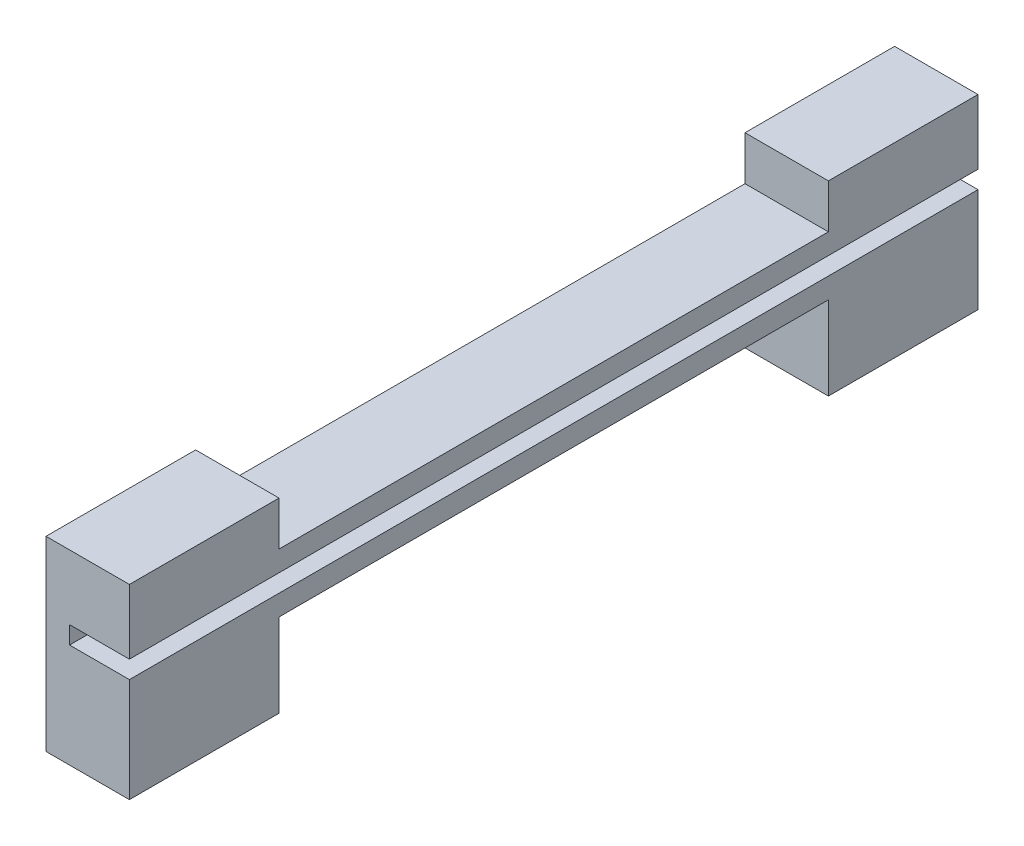
from build123d import *

# Parameters (mm, degrees)
BOSS_EXTRUDE2_DEPTH = 8.5
SKETCH6_W           = 6
SKETCH6_H           = 1.7
CUT_EXTRUDE3_DEPTH  = 89.201473911
SKETCH20_W          = 8.5
SKETCH20_H          = 15.25
BOSS_EXTRUDE3_DEPTH = 4
SKETCH23_W          = 8.5
SKETCH23_H          = 15.25
BOSS_EXTRUDE4_DEPTH = 4
SKETCH45_W          = 6
SKETCH45_H          = 86.5
CUT_EXTRUDE7_DEPTH  = 0.05
SKETCH46_W          = 86.5
SKETCH46_H          = 1.75
CUT_EXTRUDE8_DEPTH  = 0.1
SKETCH47_W          = 6.1
SKETCH47_H          = 86.5
CUT_EXTRUDE9_DEPTH  = 0.05


with BuildPart() as part:
    # Sketch5 → Boss-Extrude2 (new body)
    with BuildSketch(Plane(origin=(0, 0, 0), x_dir=(0, 0, -1), z_dir=(1, 0, 0))):
        Polygon((0, 0), (15.25, 0), (15.25, 4.5), (71.25, 4.5), (71.25, 0), (86.5, 0), (86.5, 15), (71.25, 15), (71.25, 10.5), (15.25, 10.5), (15.25, 15), (0, 15), align=None)
    extrude(amount=BOSS_EXTRUDE2_DEPTH)

    # Sketch6 → Cut-Extrude3 (cut, through all)
    with BuildSketch(Plane.XY):
        with Locations((5.5, 7.5)):
            Rectangle(SKETCH6_W, SKETCH6_H)
    extrude(amount=-CUT_EXTRUDE3_DEPTH, mode=Mode.SUBTRACT)

    # Sketch20 → Boss-Extrude3 (add)
    with BuildSketch(Plane.XZ):
        with Locations((4.25, -7.625)):
            Rectangle(SKETCH20_W, SKETCH20_H)
    extrude(amount=BOSS_EXTRUDE3_DEPTH)

    # Sketch23 → Boss-Extrude4 (add)
    with BuildSketch(Plane.XZ):
        with Locations((4.25, -78.875)):
            Rectangle(SKETCH23_W, SKETCH23_H)
    extrude(amount=BOSS_EXTRUDE4_DEPTH)

    # Sketch45 → Cut-Extrude7 (cut)
    with BuildSketch(Plane(origin=(0, 6.65, 0), x_dir=(1, 0, 0), z_dir=(0, 1, 0))):
        with Locations((5.5, 43.25)):
            Rectangle(SKETCH45_W, SKETCH45_H)
    extrude(amount=-CUT_EXTRUDE7_DEPTH, mode=Mode.SUBTRACT)

    # Sketch46 → Cut-Extrude8 (cut)
    with BuildSketch(Plane(origin=(2.5, 0, 0), x_dir=(0, 0, -1), z_dir=(1, 0, 0))):
        with Locations((43.25, 7.475)):
            Rectangle(SKETCH46_W, SKETCH46_H)
    extrude(amount=-CUT_EXTRUDE8_DEPTH, mode=Mode.SUBTRACT)

    # Sketch47 → Cut-Extrude9 (cut)
    with BuildSketch(Plane.XZ.offset(-8.35)):
        with Locations((5.45, -43.25)):
            Rectangle(SKETCH47_W, SKETCH47_H)
    extrude(amount=-CUT_EXTRUDE9_DEPTH, mode=Mode.SUBTRACT)


solid = part.part
